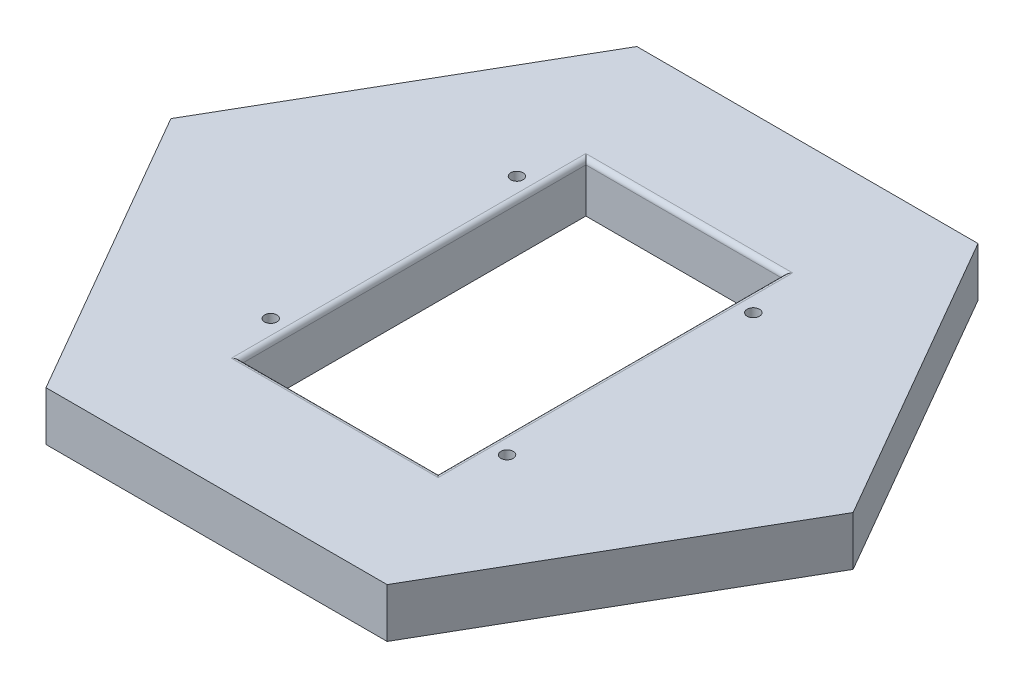
from build123d import *

# Parameters (mm, degrees)
BOSS_EXTRUDE1_DEPTH = 5
SKETCH2_R           = 9
CUT_EXTRUDE1_DEPTH  = 5
SKETCH3_R           = 1.25
SKETCH3_W           = 40
SKETCH3_H           = 70
CUT_EXTRUDE2_DEPTH  = 10
FILLET1_R           = 1


with BuildPart() as part:
    # Sketch1 → Boss-Extrude1 (new, symmetric)
    with BuildSketch(Plane(origin=(0, 0, 0), x_dir=(1, 0, 0), z_dir=(0, 1, 0))):
        Polygon((69.282032303, 0), (34.641016151, 60), (-34.641016151, 60), (-69.282032303, 0), (-34.641016151, -60), (34.641016151, -60), align=None)
    extrude(amount=BOSS_EXTRUDE1_DEPTH, both=True)

    # Sketch2 → Cut-Extrude1 (cut)
    with BuildSketch(Plane(origin=(0, -5, 0), x_dir=(-1, 0, 0), z_dir=(0, -1, 0))):
        with Locations((-25.980762114, -45)):
            Circle(SKETCH2_R)
        with Locations((-51.961524227, 0)):
            Circle(SKETCH2_R)
        with Locations((-25.980762114, 45)):
            Circle(SKETCH2_R)
        with Locations((25.980762114, 45)):
            Circle(SKETCH2_R)
        with Locations((51.961524227, 0)):
            Circle(SKETCH2_R)
        with Locations((25.980762114, -45)):
            Circle(SKETCH2_R)
    extrude(amount=-CUT_EXTRUDE1_DEPTH, mode=Mode.SUBTRACT)

    # Sketch3 → Cut-Extrude2 (cut)
    with BuildSketch(Plane(origin=(0, 5, 0), x_dir=(1, 0, 0), z_dir=(0, 1, 0))):
        with Locations((-24, 25)):
            Circle(SKETCH3_R)
        with Locations((24, 25)):
            Circle(SKETCH3_R)
        with Locations((24, -25)):
            Circle(SKETCH3_R)
        with Locations((-24, -25)):
            Circle(SKETCH3_R)
        Rectangle(SKETCH3_W, SKETCH3_H)
    extrude(amount=-CUT_EXTRUDE2_DEPTH, mode=Mode.SUBTRACT)

    # Fillet1
    fillet1_edges = [part.edges().sort_by_distance(p)[0] for p in [
        (0, 5, 35),
        (20, 5, 0),
        (0, 5, -35),
        (-20, 5, 0),
    ]]
    fillet(fillet1_edges, radius=FILLET1_R)


solid = part.part
